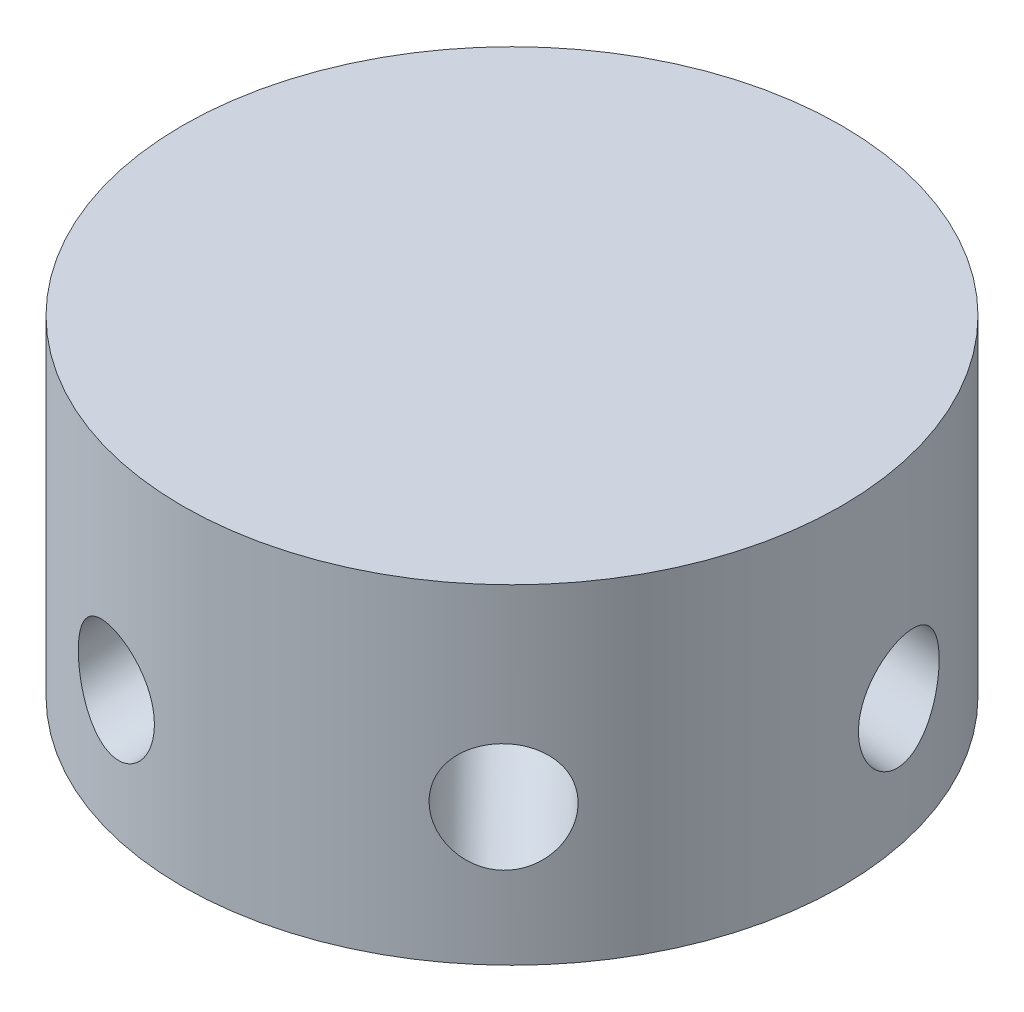
from build123d import *

# Parameters (mm, degrees)
BASE_DEPTH        = 3
BASE_DEPTH_BACK   = 7
SKETCH1_R         = 10
SKETCH2_R         = 1.6
HOLE1_DEPTH       = 19.934353276
HOLE1MIRROR_COUNT = 2
SKETCH3_R         = 1.6
HOLE2_DEPTH       = 19.445737601
HOLE2MIRROR_COUNT = 2
SKETCH4_R         = 1.6
HOLE3_DEPTH       = 19.389503466
HOLE3MIRROR_COUNT = 2


with BuildPart() as part:
    # Sketch1 → base (new, two sides: drawn at the far end of the back side and taken through both)
    with BuildSketch(Plane(origin=(0, 0, 0), x_dir=(1, 0, 0), z_dir=(0, 1, 0)).offset(-BASE_DEPTH_BACK)):
        Circle(SKETCH1_R)
    extrude(amount=BASE_DEPTH + BASE_DEPTH_BACK)

    # Sketch2 → hole1 (cut, through all)
    with BuildSketch(Plane(origin=(2.670502563, -1.093066116, 2.770130417), x_dir=(-0.6558691872850446, 0.22429081675253856, 0.7207837669443827), z_dir=(-0.6676256406563905, 0.27326652891267483, -0.692532604369038))):
        Circle(SKETCH2_R)
    hole1 = extrude(amount=-HOLE1_DEPTH, mode=Mode.SUBTRACT)

    # hole1mirror: hole1 ×2 about axis
    hole1mirror_axis = Axis((0, 5.5, 0), (0, -1, 0))
    for i in range(1, HOLE1MIRROR_COUNT):
        add(hole1.rotate(hole1mirror_axis, i * 360 / HOLE1MIRROR_COUNT), mode=Mode.SUBTRACT)

    # Sketch3 → hole2 (cut, through all)
    with BuildSketch(Plane(origin=(-0.941672921, -1.236067977, 3.685836142), x_dir=(-0.9718935871364875, 0.07382318789513377, -0.22354639834264944), z_dir=(0.23541823021467095, 0.3090169943749464, -0.921459035481267))):
        Circle(SKETCH3_R)
    hole2 = extrude(amount=-HOLE2_DEPTH, mode=Mode.SUBTRACT)

    # hole2mirror: hole2 ×2 about axis
    hole2mirror_axis = Axis((0, 5.5, 0), (0, -1, 0))
    for i in range(1, HOLE2MIRROR_COUNT):
        add(hole2.rotate(hole2mirror_axis, i * 360 / HOLE2MIRROR_COUNT), mode=Mode.SUBTRACT)

    # Sketch4 → hole3 (cut, through all)
    with BuildSketch(Plane(origin=(-3.717841, -1.236067977, 0.806098168), x_dir=(-0.19123247894507908, -0.06357892752956036, -0.979483465389136), z_dir=(0.9294602499075393, 0.30901699437494623, -0.20152454200243008))):
        Circle(SKETCH4_R)
    hole3 = extrude(amount=-HOLE3_DEPTH, mode=Mode.SUBTRACT)

    # hole3mirror: hole3 ×2 about axis
    hole3mirror_axis = Axis((0, 5.5, 0), (0, -1, 0))
    for i in range(1, HOLE3MIRROR_COUNT):
        add(hole3.rotate(hole3mirror_axis, i * 360 / HOLE3MIRROR_COUNT), mode=Mode.SUBTRACT)


solid = part.part
